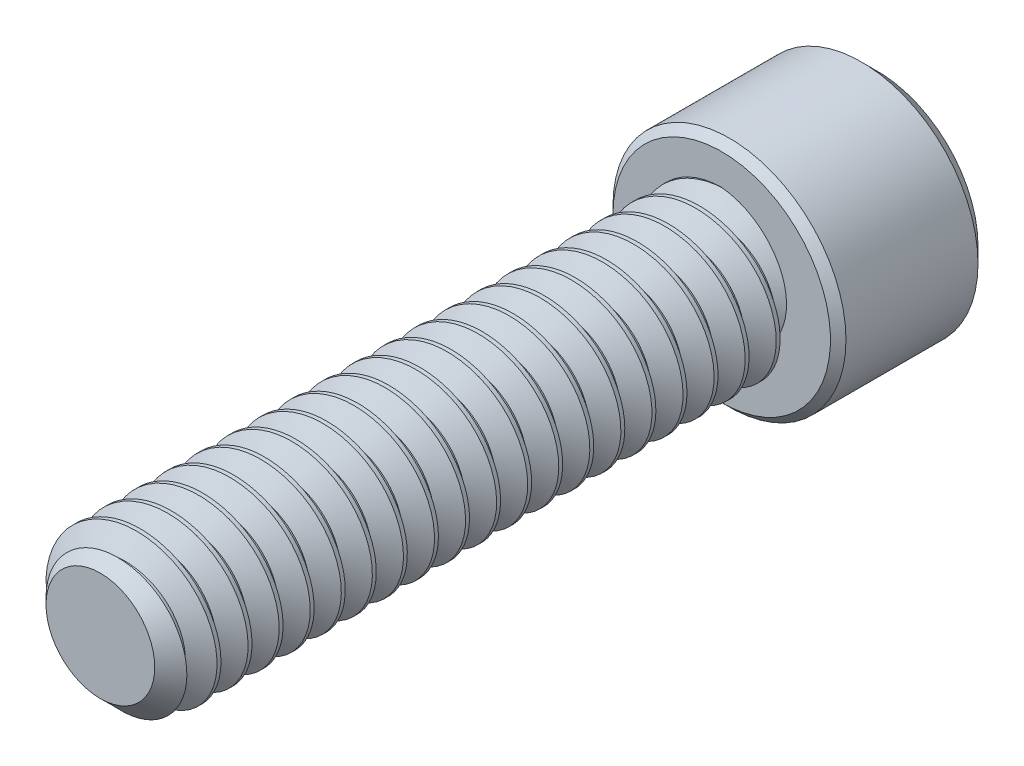
from build123d import *

# Parameters (mm, degrees)
SKETCH1_R          = 3.175
EXTRUDE1_DEPTH     = 25.4
CHAMFER3_SIZE      = 0.9525
CUT_SWEEP1_PITCH   = 1.27
SKETCH6_R          = 4.7625
EXTRUDE2_DEPTH     = 6.35
CUT_EXTRUDE1_DEPTH = 3.571875
SKETCH8_R          = 2.749630657
CUT_EXTRUDE2_DEPTH = 0.635
CUT_EXTRUDE2_DRAFT = -45
CHAMFER1_SIZE      = 0.635
CHAMFER2_SIZE      = 0.3175


with BuildPart() as part:
    # Sketch1 → Extrude1 (new body)
    with BuildSketch(Plane.XY):
        Circle(SKETCH1_R)
    extrude(amount=-EXTRUDE1_DEPTH)

    # Chamfer3
    chamfer3_edges = [part.edges().sort_by_distance(p)[0] for p in [
        (-3.175, 0, 0),
    ]]
    chamfer(chamfer3_edges, length=CHAMFER3_SIZE)

    # Cut-Sweep1: the profile of Sketch3 profile screwed along a right-hand helix of 21 turns, 6 arcs to a turn; built about Z, then put on its axis
    cut_sweep1_z = Axis((0, 0, 0), (0, 0, 1))
    cut_sweep1_corners = [(3.1753, 0, -1.111423205), (2.350110803, 0, -0.635), (2.350110803, 0, -0.47625), (3.1753, 0, 0.000173205)]
    with BuildLine(mode=Mode.PRIVATE) as cut_sweep1_profile:
        Line(cut_sweep1_corners[0], cut_sweep1_corners[1])
        Line(cut_sweep1_corners[1], cut_sweep1_corners[2])
        Line(cut_sweep1_corners[2], cut_sweep1_corners[3])
        Line(cut_sweep1_corners[3], cut_sweep1_corners[0])
    cut_sweep1_cap = Face(cut_sweep1_profile.wire())
    cut_sweep1_turn_angles = [0, 30, 60, 90, 120, 150, 180, 210, 240, 270, 300, 330, 360]
    cut_sweep1_turn_weights = [1, 0.8660254037844387, 1, 0.8660254037844387, 1, 0.8660254037844387, 1, 0.8660254037844387, 1, 0.8660254037844387, 1, 0.8660254037844387, 1]
    cut_sweep1_turn_rails = [Edge.make_bspline([Vector(p[0], p[1], 0).rotate(cut_sweep1_z, cut_sweep1_turn_angles[k]) / cut_sweep1_turn_weights[k] + Vector(0, 0, p[2] + CUT_SWEEP1_PITCH * cut_sweep1_turn_angles[k] / 360) for k in range(13)], [0, 0, 0, 1, 1, 2, 2, 3, 3, 4, 4, 5, 5, 6, 6, 6], 2, cut_sweep1_turn_weights) for p in cut_sweep1_corners]
    cut_sweep1_turn_sides = [Face.make_surface_from_curves(cut_sweep1_turn_rails[p[0]], cut_sweep1_turn_rails[p[1]]) for p in [(0, 1), (1, 2), (2, 3), (3, 0)]]
    cut_sweep1 = Plane(origin=(0, 0, 0), x_dir=(0, 1, 0), z_dir=(0, 0, -1)) * Solid(Shell([*[p.moved(Location((0, 0, CUT_SWEEP1_PITCH * i))) for i in range(21) for p in cut_sweep1_turn_sides], cut_sweep1_cap, cut_sweep1_cap.rotate(cut_sweep1_z, 7560).moved(Location((0, 0, CUT_SWEEP1_PITCH * 7560 / 360)))]))
    add(cut_sweep1, mode=Mode.SUBTRACT)

    # Sketch6 → Extrude2 (add)
    with BuildSketch(Plane(origin=(0, 0, -25.4), x_dir=(-1, 0, 0), z_dir=(0, 0, -1))):
        Circle(SKETCH6_R)
    extrude(amount=EXTRUDE2_DEPTH)

    # Sketch7 → Cut-Extrude1 (cut)
    with BuildSketch(Plane(origin=(0, 0, -31.75), x_dir=(-1, 0, 0), z_dir=(0, 0, -1))):
        Polygon((0, 2.749630657), (-2.38125, 1.374815329), (-2.38125, -1.374815329), (0, -2.749630657), (2.38125, -1.374815329), (2.38125, 1.374815329), align=None)
    extrude(amount=-CUT_EXTRUDE1_DEPTH, mode=Mode.SUBTRACT)


with BuildPart() as cut_extrude2_tool:
    # Sketch8 → Cut-Extrude2 (with draft: the straight prism first)
    with BuildSketch(Plane(origin=(0, 0, -31.75), x_dir=(-1, 0, 0), z_dir=(0, 0, -1))):
        Circle(SKETCH8_R)
    extrude(amount=-CUT_EXTRUDE2_DEPTH)
    # Cut-Extrude2: the draft: its side faces are tilted about the plane it starts from
    cut_extrude2_sides = [cut_extrude2_tool.faces().sort_by_distance(p)[0] for p in [
        (2.749630657, 0, -31.4325),
    ]]
    draft(cut_extrude2_sides, Plane(origin=(0, 0, -31.75), x_dir=(-1, 0, 0), z_dir=(0, 0, -1)), CUT_EXTRUDE2_DRAFT)


with BuildPart() as part_1:
    add(part.part)

    # Cut-Extrude2: cut by cut_extrude2_tool
    add(cut_extrude2_tool.part, mode=Mode.SUBTRACT)

    # Chamfer1
    chamfer1_edges = [part_1.edges().sort_by_distance(p)[0] for p in [
        (4.7625, 0, -31.75),
    ]]
    chamfer(chamfer1_edges, length=CHAMFER1_SIZE)

    # Chamfer2
    chamfer2_edges = [part_1.edges().sort_by_distance(p)[0] for p in [
        (4.7625, 0, -25.4),
    ]]
    chamfer(chamfer2_edges, length=CHAMFER2_SIZE)


solid = part_1.part
